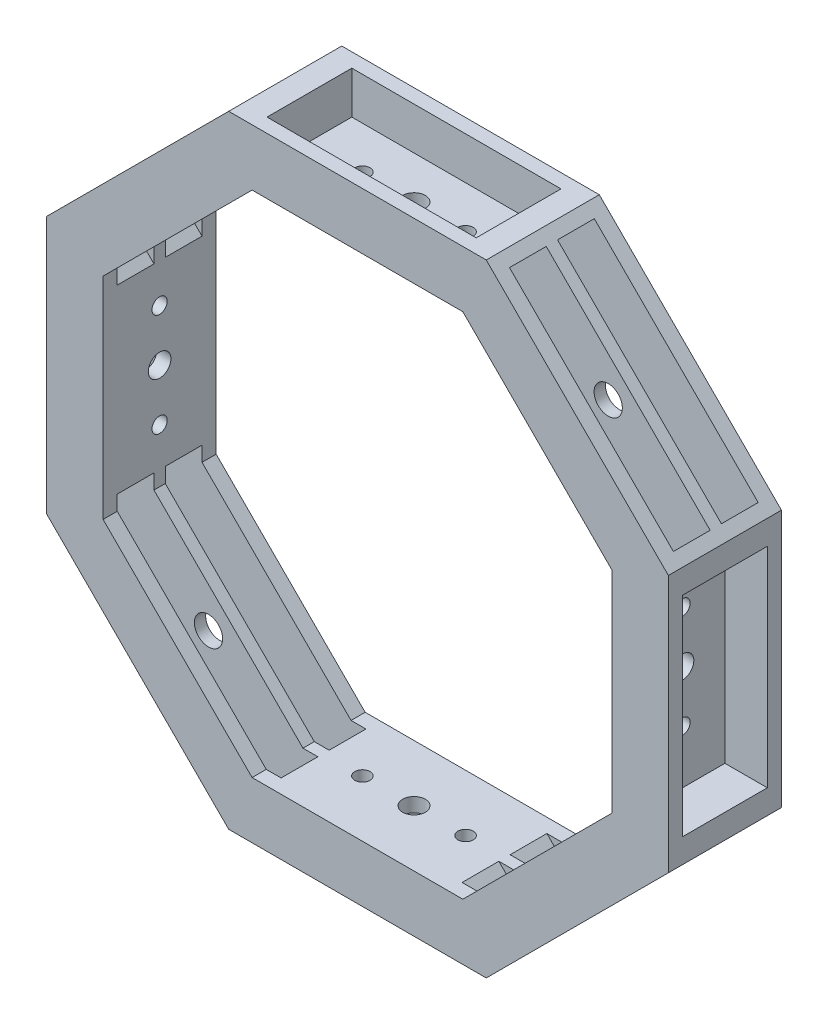
from build123d import *

# Parameters (mm, degrees)
RESSALTO_EXTRUS_O1_DEPTH = 40
CORTE_EXTRUS_O1_START    = -15
ESBO_O2_W                = 30
ESBO_O2_H                = 74
ESBO_O2_R                = 2.7
ESBO_O2_R_2              = 4
CORTE_EXTRUS_O1_DEPTH    = 265.198715888
CORTE_EXTRUS_O6_REACH    = 251.199
ESBO_O2_3_R              = 4
ESBO_O2_3_R_2            = 2.7
CORTE_EXTRUS_O2_REACH    = 251.199
ESBO_O3_R                = 4
ESBO_O3_R_2              = 2.7
ESBO_O3_3_W              = 74
ESBO_O3_3_H              = 30
ESBO_O3_3_R              = 2.7
ESBO_O3_3_R_2            = 4
CORTE_EXTRUS_O7_DEPTH    = 15
CORTE_EXTRUS_O3_REACH    = 270.559
ESBO_O4_W                = 13
ESBO_O4_H                = 82
CORTE_EXTRUS_O8_REACH    = 270.559
ESBO_O9_W                = 13
ESBO_O9_H                = 82
CORTE_EXTRUS_O9_REACH    = 180.624
CORTE_EXTRUS_O9_START    = -18
ESBO_O10_R               = 5


with BuildPart() as part:
    # Esboço1 → Ressalto-extrusão1 (new body)
    with BuildSketch(Plane.XY):
        Polygon((110, 45.563491861), (45.563491861, 110), (-45.563491861, 110), (-110, 45.563491861), (-110, -45.563491861), (-45.563491861, -110), (45.563491861, -110), (110, -45.563491861), align=None)
        Polygon((90, 37.279220614), (37.279220614, 90), (-37.279220614, 90), (-90, 37.279220614), (-90, -37.279220614), (-37.279220614, -90), (37.279220614, -90), (90, -37.279220614), align=None, mode=Mode.SUBTRACT)
    extrude(amount=RESSALTO_EXTRUS_O1_DEPTH)

    # Esboço2 → Corte-extrusão1 (cut)
    with BuildSketch(Plane(origin=(110, 0, 0), x_dir=(0, 0, -1), z_dir=(1, 0, 0)).offset(CORTE_EXTRUS_O1_START)):
        with Locations((-20, 0)):
            Rectangle(ESBO_O2_W, ESBO_O2_H)
        with Locations((-20, -18.25)):
            Circle(ESBO_O2_R, mode=Mode.SUBTRACT)
        with Locations((-20, 0)):
            Circle(ESBO_O2_R_2, mode=Mode.SUBTRACT)
        with Locations((-20, 18.25)):
            Circle(ESBO_O2_R, mode=Mode.SUBTRACT)
    corte_extrus_o1 = extrude(amount=CORTE_EXTRUS_O1_DEPTH, mode=Mode.SUBTRACT)

    # Esboço2<3> → Corte-extrusão6 (cut, up to next)
    with BuildSketch(Plane(origin=(110, 0, 0), x_dir=(0, 0, -1), z_dir=(1, 0, 0)), mode=Mode.PRIVATE) as corte_extrus_o6_sk1:
        with Locations((-20, 0)):
            Circle(ESBO_O2_3_R)
    corte_extrus_o6_tool1 = extrude(corte_extrus_o6_sk1.sketch, amount=-CORTE_EXTRUS_O6_REACH, mode=Mode.PRIVATE) & part.part
    # Esboço2<3> → Corte-extrusão6 (cut, up to next)
    with BuildSketch(Plane(origin=(110, 0, 0), x_dir=(0, 0, -1), z_dir=(1, 0, 0)), mode=Mode.PRIVATE) as corte_extrus_o6_sk2:
        with Locations((-20, 18.25)):
            Circle(ESBO_O2_3_R_2)
    corte_extrus_o6_tool2 = extrude(corte_extrus_o6_sk2.sketch, amount=-CORTE_EXTRUS_O6_REACH, mode=Mode.PRIVATE) & part.part
    # Esboço2<3> → Corte-extrusão6 (cut, up to next)
    with BuildSketch(Plane(origin=(110, 0, 0), x_dir=(0, 0, -1), z_dir=(1, 0, 0)), mode=Mode.PRIVATE) as corte_extrus_o6_sk3:
        with Locations((-20, -18.25)):
            Circle(ESBO_O2_3_R_2)
    corte_extrus_o6_tool3 = extrude(corte_extrus_o6_sk3.sketch, amount=-CORTE_EXTRUS_O6_REACH, mode=Mode.PRIVATE) & part.part
    corte_extrus_o6_1 = corte_extrus_o6_tool1.solids().sort_by_distance((110, 0, 20))[0]
    add(corte_extrus_o6_1, mode=Mode.SUBTRACT)
    corte_extrus_o6_2 = corte_extrus_o6_tool2.solids().sort_by_distance((110, 18.25, 20))[0]
    add(corte_extrus_o6_2, mode=Mode.SUBTRACT)
    corte_extrus_o6_3 = corte_extrus_o6_tool3.solids().sort_by_distance((110, -18.25, 20))[0]
    add(corte_extrus_o6_3, mode=Mode.SUBTRACT)
    corte_extrus_o6 = corte_extrus_o6_1 + corte_extrus_o6_2 + corte_extrus_o6_3  # Corte-extrusão6 as one shape, for the pattern or mirror that repeats it

    # Esboço3 → Corte-extrusão2 (cut, up to next)
    with BuildSketch(Plane(origin=(0, 110, 0), x_dir=(1, 0, 0), z_dir=(0, 1, 0)), mode=Mode.PRIVATE) as corte_extrus_o2_sk1:
        with Locations((0, -20)):
            Circle(ESBO_O3_R)
    corte_extrus_o2_tool1 = extrude(corte_extrus_o2_sk1.sketch, amount=-CORTE_EXTRUS_O2_REACH, mode=Mode.PRIVATE) & part.part
    # Esboço3 → Corte-extrusão2 (cut, up to next)
    with BuildSketch(Plane(origin=(0, 110, 0), x_dir=(1, 0, 0), z_dir=(0, 1, 0)), mode=Mode.PRIVATE) as corte_extrus_o2_sk2:
        with Locations((18.25, -20)):
            Circle(ESBO_O3_R_2)
    corte_extrus_o2_tool2 = extrude(corte_extrus_o2_sk2.sketch, amount=-CORTE_EXTRUS_O2_REACH, mode=Mode.PRIVATE) & part.part
    # Esboço3 → Corte-extrusão2 (cut, up to next)
    with BuildSketch(Plane(origin=(0, 110, 0), x_dir=(1, 0, 0), z_dir=(0, 1, 0)), mode=Mode.PRIVATE) as corte_extrus_o2_sk3:
        with Locations((-18.25, -20)):
            Circle(ESBO_O3_R_2)
    corte_extrus_o2_tool3 = extrude(corte_extrus_o2_sk3.sketch, amount=-CORTE_EXTRUS_O2_REACH, mode=Mode.PRIVATE) & part.part
    corte_extrus_o2_1 = corte_extrus_o2_tool1.solids().sort_by_distance((0, 110, 20))[0]
    add(corte_extrus_o2_1, mode=Mode.SUBTRACT)
    corte_extrus_o2_2 = corte_extrus_o2_tool2.solids().sort_by_distance((18.25, 110, 20))[0]
    add(corte_extrus_o2_2, mode=Mode.SUBTRACT)
    corte_extrus_o2_3 = corte_extrus_o2_tool3.solids().sort_by_distance((-18.25, 110, 20))[0]
    add(corte_extrus_o2_3, mode=Mode.SUBTRACT)
    corte_extrus_o2 = corte_extrus_o2_1 + corte_extrus_o2_2 + corte_extrus_o2_3  # Corte-extrusão2 as one shape, for the pattern or mirror that repeats it

    # Espelhar1: Corte-extrusão1, Corte-extrusão6 across plane
    add(corte_extrus_o1.mirror(Plane(origin=(0, 0, 0), x_dir=(0, 0, 1), z_dir=(1, 0, 0))), mode=Mode.SUBTRACT)
    add(corte_extrus_o6.mirror(Plane(origin=(0, 0, 0), x_dir=(0, 0, 1), z_dir=(1, 0, 0))), mode=Mode.SUBTRACT)

    # Esboço3<3> → Corte-extrusão7 (cut)
    with BuildSketch(Plane(origin=(0, 110, 0), x_dir=(1, 0, 0), z_dir=(0, 1, 0))):
        with Locations((0, -20)):
            Rectangle(ESBO_O3_3_W, ESBO_O3_3_H)
        with Locations((-18.25, -20)):
            Circle(ESBO_O3_3_R, mode=Mode.SUBTRACT)
        with Locations((0, -20)):
            Circle(ESBO_O3_3_R_2, mode=Mode.SUBTRACT)
        with Locations((18.25, -20)):
            Circle(ESBO_O3_3_R, mode=Mode.SUBTRACT)
    corte_extrus_o7 = extrude(amount=-CORTE_EXTRUS_O7_DEPTH, mode=Mode.SUBTRACT)

    # Espelhar2: Corte-extrusão2, Corte-extrusão7 across plane
    add(corte_extrus_o2.mirror(Plane.ZX), mode=Mode.SUBTRACT)
    add(corte_extrus_o7.mirror(Plane.ZX), mode=Mode.SUBTRACT)

    # Esboço4 → Corte-extrusão3 (cut, up to next)
    with BuildSketch(Plane(origin=(77.781745931, 77.781745931, 0), x_dir=(0, 0, -1), z_dir=(0.707106781186547, 0.7071067811865481, 0)), mode=Mode.PRIVATE) as corte_extrus_o3_sk1:
        with Locations((-28.5, 0)):
            Rectangle(ESBO_O4_W, ESBO_O4_H)
    corte_extrus_o3_tool1 = extrude(corte_extrus_o3_sk1.sketch, amount=-CORTE_EXTRUS_O3_REACH, mode=Mode.PRIVATE) & part.part
    # Esboço4 → Corte-extrusão3 (cut, up to next)
    with BuildSketch(Plane(origin=(77.781745931, 77.781745931, 0), x_dir=(0, 0, -1), z_dir=(0.707106781186547, 0.7071067811865481, 0)), mode=Mode.PRIVATE) as corte_extrus_o3_sk2:
        with Locations((-11.5, 0)):
            Rectangle(ESBO_O4_W, ESBO_O4_H)
    corte_extrus_o3_tool2 = extrude(corte_extrus_o3_sk2.sketch, amount=-CORTE_EXTRUS_O3_REACH, mode=Mode.PRIVATE) & part.part
    corte_extrus_o3_1 = corte_extrus_o3_tool1.solids().sort_by_distance((77.781746, 77.781746, 28.5))[0]
    add(corte_extrus_o3_1, mode=Mode.SUBTRACT)
    corte_extrus_o3_2 = corte_extrus_o3_tool2.solids().sort_by_distance((77.781746, 77.781746, 11.5))[0]
    add(corte_extrus_o3_2, mode=Mode.SUBTRACT)
    corte_extrus_o3 = corte_extrus_o3_1 + corte_extrus_o3_2  # Corte-extrusão3 as one shape, for the pattern or mirror that repeats it

    # Espelhar3: Corte-extrusão3 across plane
    add(corte_extrus_o3.mirror(Plane(origin=(0, 0, 0), x_dir=(0, 0, 1), z_dir=(0.7071067811865475, 0.7071067811865477, 0))), mode=Mode.SUBTRACT)

    # Esboço9 → Corte-extrusão8 (cut, up to next)
    with BuildSketch(Plane(origin=(77.781745931, -77.781745931, 0), x_dir=(0, 0, -1), z_dir=(0.7071067811865479, -0.7071067811865471, 0)), mode=Mode.PRIVATE) as corte_extrus_o8_sk1:
        with Locations((-28.5, 0)):
            Rectangle(ESBO_O9_W, ESBO_O9_H)
    corte_extrus_o8_tool1 = extrude(corte_extrus_o8_sk1.sketch, amount=-CORTE_EXTRUS_O8_REACH, mode=Mode.PRIVATE) & part.part
    # Esboço9 → Corte-extrusão8 (cut, up to next)
    with BuildSketch(Plane(origin=(77.781745931, -77.781745931, 0), x_dir=(0, 0, -1), z_dir=(0.7071067811865479, -0.7071067811865471, 0)), mode=Mode.PRIVATE) as corte_extrus_o8_sk2:
        with Locations((-11.5, 0)):
            Rectangle(ESBO_O9_W, ESBO_O9_H)
    corte_extrus_o8_tool2 = extrude(corte_extrus_o8_sk2.sketch, amount=-CORTE_EXTRUS_O8_REACH, mode=Mode.PRIVATE) & part.part
    corte_extrus_o8_1 = corte_extrus_o8_tool1.solids().sort_by_distance((77.781746, -77.781746, 28.5))[0]
    add(corte_extrus_o8_1, mode=Mode.SUBTRACT)
    corte_extrus_o8_2 = corte_extrus_o8_tool2.solids().sort_by_distance((77.781746, -77.781746, 11.5))[0]
    add(corte_extrus_o8_2, mode=Mode.SUBTRACT)
    corte_extrus_o8 = corte_extrus_o8_1 + corte_extrus_o8_2  # Corte-extrusão8 as one shape, for the pattern or mirror that repeats it

    # Espelhar4: Corte-extrusão8 across plane
    add(corte_extrus_o8.mirror(Plane(origin=(0, 0, 0), x_dir=(0, 0, 1), z_dir=(0.7071067811865475, -0.7071067811865477, 0))), mode=Mode.SUBTRACT)

    # Esboço10 → Corte-extrusão9 (cut, up to next)
    with BuildSketch(Plane.XY.offset(40).offset(CORTE_EXTRUS_O9_START), mode=Mode.PRIVATE) as corte_extrus_o9_sk1:
        with Locations((0, -100)):
            Circle(ESBO_O10_R)
    corte_extrus_o9_tool1 = extrude(corte_extrus_o9_sk1.sketch, amount=-CORTE_EXTRUS_O9_REACH, mode=Mode.PRIVATE) & part.part
    # Esboço10 → Corte-extrusão9 (cut, up to next)
    with BuildSketch(Plane.XY.offset(40).offset(CORTE_EXTRUS_O9_START), mode=Mode.PRIVATE) as corte_extrus_o9_sk2:
        with Locations((-70.710678119, -70.710678119)):
            Circle(ESBO_O10_R)
    corte_extrus_o9_tool2 = extrude(corte_extrus_o9_sk2.sketch, amount=-CORTE_EXTRUS_O9_REACH, mode=Mode.PRIVATE) & part.part
    # Esboço10 → Corte-extrusão9 (cut, up to next)
    with BuildSketch(Plane.XY.offset(40).offset(CORTE_EXTRUS_O9_START), mode=Mode.PRIVATE) as corte_extrus_o9_sk3:
        with Locations((-70.710678119, 70.710678119)):
            Circle(ESBO_O10_R)
    corte_extrus_o9_tool3 = extrude(corte_extrus_o9_sk3.sketch, amount=-CORTE_EXTRUS_O9_REACH, mode=Mode.PRIVATE) & part.part
    # Esboço10 → Corte-extrusão9 (cut, up to next)
    with BuildSketch(Plane.XY.offset(40).offset(CORTE_EXTRUS_O9_START), mode=Mode.PRIVATE) as corte_extrus_o9_sk4:
        with Locations((70.710678119, 70.710678119)):
            Circle(ESBO_O10_R)
    corte_extrus_o9_tool4 = extrude(corte_extrus_o9_sk4.sketch, amount=-CORTE_EXTRUS_O9_REACH, mode=Mode.PRIVATE) & part.part
    # Esboço10 → Corte-extrusão9 (cut, up to next)
    with BuildSketch(Plane.XY.offset(40).offset(CORTE_EXTRUS_O9_START), mode=Mode.PRIVATE) as corte_extrus_o9_sk5:
        with Locations((70.710678119, -70.710678119)):
            Circle(ESBO_O10_R)
    corte_extrus_o9_tool5 = extrude(corte_extrus_o9_sk5.sketch, amount=-CORTE_EXTRUS_O9_REACH, mode=Mode.PRIVATE) & part.part
    add(corte_extrus_o9_tool1.solids().sort_by_distance((0, -100, 22))[0], mode=Mode.SUBTRACT)
    add(corte_extrus_o9_tool2.solids().sort_by_distance((-70.710678, -70.710678, 22))[0], mode=Mode.SUBTRACT)
    add(corte_extrus_o9_tool3.solids().sort_by_distance((-70.710678, 70.710678, 22))[0], mode=Mode.SUBTRACT)
    add(corte_extrus_o9_tool4.solids().sort_by_distance((70.710678, 70.710678, 22))[0], mode=Mode.SUBTRACT)
    add(corte_extrus_o9_tool5.solids().sort_by_distance((70.710678, -70.710678, 22))[0], mode=Mode.SUBTRACT)


solid = part.part
